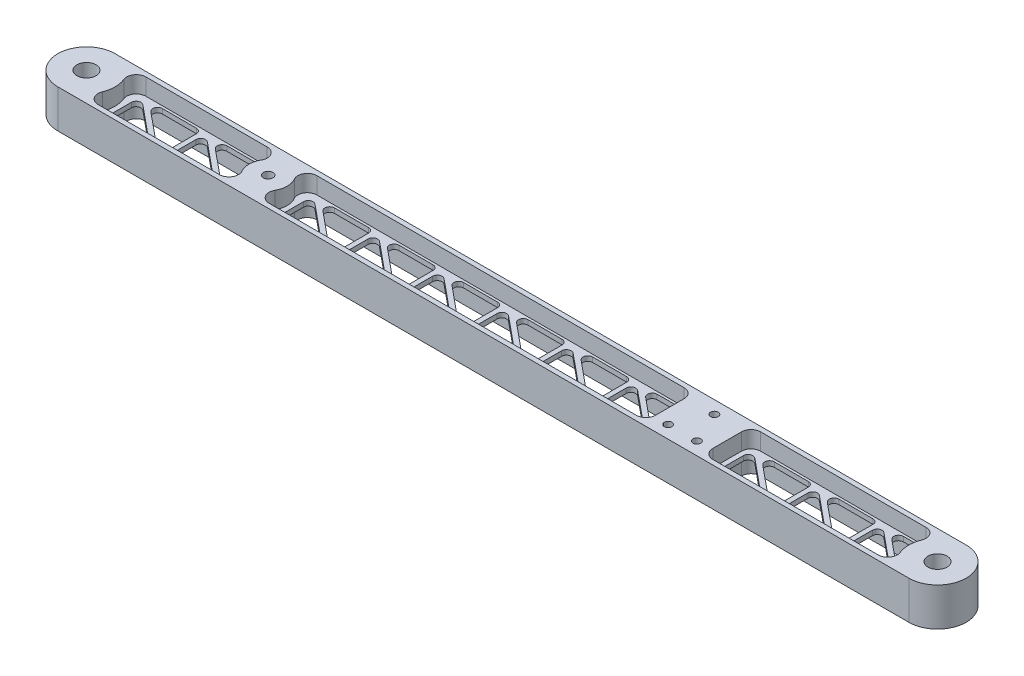
from build123d import *

# Parameters (mm, degrees)
SKETCH2_R                   = 6.35
SKETCH2_R_2                 = 3.175
BOSS_EXTRUDE1_DEPTH         = 25.4
CUT_EXTRUDE2_REACH          = 587.992
CUT_EXTRUDE3_DEPTH          = 11.1125
FILLET1_R                   = 3.175
F_1_4_20_TAPPED_HOLE1_D     = 5.1054
F_1_4_20_TAPPED_HOLE1_DEPTH = 19.05
F_1_4_20_TAPPED_HOLE1_TIP   = 1.533816902
FILLET3_R                   = 3.175
FILLET4_R                   = 3.175
FILLET5_R                   = 6.35
FILLET6_R                   = 3.175


with BuildPart() as part:
    # Sketch2 → Boss-Extrude1 (new body)
    with BuildSketch(Plane(origin=(0, 0, 0), x_dir=(1, 0, 0), z_dir=(0, 1, 0))):
        with BuildLine():
            ThreePointArc((0, 38.1), (-19.05, 19.05), (0, 0))
            Line((0, 0), (565.15, 0))
            ThreePointArc((565.15, 0), (584.2, 19.05), (565.15, 38.1))
            Line((565.15, 38.1), (0, 38.1))
        make_face()
        with Locations(Location((0, 19.05, 0), (0, 0, 270))):
            Circle(SKETCH2_R, mode=Mode.SUBTRACT)
        with Locations(Location((120.65, 19.05, 0), (0, 0, 270))):
            Circle(SKETCH2_R_2, mode=Mode.SUBTRACT)
        with Locations(Location((565.15, 19.05, 0), (0, 0, 270))):
            Circle(SKETCH2_R, mode=Mode.SUBTRACT)
    extrude(amount=BOSS_EXTRUDE1_DEPTH)

    # Sketch13 → Cut-Extrude2 (cut, up to next)
    with BuildSketch(Plane(origin=(0, 25.4, 0), x_dir=(1, 0, 0), z_dir=(0, 1, 0)), mode=Mode.PRIVATE) as cut_extrude2_sk1:
        Polygon((56.91846966, 4.7625), (22.225, 33.3375), (22.225, 4.7625), align=None)
    cut_extrude2_tool1 = extrude(cut_extrude2_sk1.sketch, amount=-CUT_EXTRUDE2_REACH, mode=Mode.PRIVATE) & part.part
    # Sketch13 → Cut-Extrude2 (cut, up to next)
    with BuildSketch(Plane(origin=(0, 25.4, 0), x_dir=(1, 0, 0), z_dir=(0, 1, 0)), mode=Mode.PRIVATE) as cut_extrude2_sk2:
        Polygon((61.9125, 33.3375), (27.21903034, 33.3375), (61.9125, 4.7625), align=None)
    cut_extrude2_tool2 = extrude(cut_extrude2_sk2.sketch, amount=-CUT_EXTRUDE2_REACH, mode=Mode.PRIVATE) & part.part
    # Sketch13 → Cut-Extrude2 (cut, up to next)
    with BuildSketch(Plane(origin=(0, 25.4, 0), x_dir=(1, 0, 0), z_dir=(0, 1, 0)), mode=Mode.PRIVATE) as cut_extrude2_sk3:
        Polygon((99.78096966, 4.7625), (65.0875, 33.3375), (65.0875, 4.7625), align=None)
    cut_extrude2_tool3 = extrude(cut_extrude2_sk3.sketch, amount=-CUT_EXTRUDE2_REACH, mode=Mode.PRIVATE) & part.part
    # Sketch13 → Cut-Extrude2 (cut, up to next)
    with BuildSketch(Plane(origin=(0, 25.4, 0), x_dir=(1, 0, 0), z_dir=(0, 1, 0)), mode=Mode.PRIVATE) as cut_extrude2_sk4:
        Polygon((104.775, 33.3375), (70.08153034, 33.3375), (104.775, 4.7625), align=None)
    cut_extrude2_tool4 = extrude(cut_extrude2_sk4.sketch, amount=-CUT_EXTRUDE2_REACH, mode=Mode.PRIVATE) & part.part
    # Sketch13 → Cut-Extrude2 (cut, up to next)
    with BuildSketch(Plane(origin=(0, 25.4, 0), x_dir=(1, 0, 0), z_dir=(0, 1, 0)), mode=Mode.PRIVATE) as cut_extrude2_sk5:
        Polygon((384.175, 5.879333612), (350.8375, 33.3375), (350.8375, 4.7625), (384.175, 4.7625), align=None)
    cut_extrude2_tool5 = extrude(cut_extrude2_sk5.sketch, amount=-CUT_EXTRUDE2_REACH, mode=Mode.PRIVATE) & part.part
    # Sketch13 → Cut-Extrude2 (cut, up to next)
    with BuildSketch(Plane(origin=(0, 25.4, 0), x_dir=(1, 0, 0), z_dir=(0, 1, 0)), mode=Mode.PRIVATE) as cut_extrude2_sk6:
        Polygon((384.175, 33.3375), (355.83153034, 33.3375), (384.175, 9.992626931), align=None)
    cut_extrude2_tool6 = extrude(cut_extrude2_sk6.sketch, amount=-CUT_EXTRUDE2_REACH, mode=Mode.PRIVATE) & part.part
    # Sketch13 → Cut-Extrude2 (cut, up to next)
    with BuildSketch(Plane(origin=(0, 25.4, 0), x_dir=(1, 0, 0), z_dir=(0, 1, 0)), mode=Mode.PRIVATE) as cut_extrude2_sk7:
        Polygon((171.21846966, 4.7625), (136.525, 33.3375), (136.525, 4.7625), align=None)
    cut_extrude2_tool7 = extrude(cut_extrude2_sk7.sketch, amount=-CUT_EXTRUDE2_REACH, mode=Mode.PRIVATE) & part.part
    # Sketch13 → Cut-Extrude2 (cut, up to next)
    with BuildSketch(Plane(origin=(0, 25.4, 0), x_dir=(1, 0, 0), z_dir=(0, 1, 0)), mode=Mode.PRIVATE) as cut_extrude2_sk8:
        Polygon((176.2125, 33.3375), (141.51903034, 33.3375), (176.2125, 4.7625), align=None)
    cut_extrude2_tool8 = extrude(cut_extrude2_sk8.sketch, amount=-CUT_EXTRUDE2_REACH, mode=Mode.PRIVATE) & part.part
    # Sketch13 → Cut-Extrude2 (cut, up to next)
    with BuildSketch(Plane(origin=(0, 25.4, 0), x_dir=(1, 0, 0), z_dir=(0, 1, 0)), mode=Mode.PRIVATE) as cut_extrude2_sk9:
        Polygon((214.08096966, 4.7625), (179.3875, 33.3375), (179.3875, 4.7625), align=None)
    cut_extrude2_tool9 = extrude(cut_extrude2_sk9.sketch, amount=-CUT_EXTRUDE2_REACH, mode=Mode.PRIVATE) & part.part
    # Sketch13 → Cut-Extrude2 (cut, up to next)
    with BuildSketch(Plane(origin=(0, 25.4, 0), x_dir=(1, 0, 0), z_dir=(0, 1, 0)), mode=Mode.PRIVATE) as cut_extrude2_sk10:
        Polygon((219.075, 33.3375), (184.38153034, 33.3375), (219.075, 4.7625), align=None)
    cut_extrude2_tool10 = extrude(cut_extrude2_sk10.sketch, amount=-CUT_EXTRUDE2_REACH, mode=Mode.PRIVATE) & part.part
    # Sketch13 → Cut-Extrude2 (cut, up to next)
    with BuildSketch(Plane(origin=(0, 25.4, 0), x_dir=(1, 0, 0), z_dir=(0, 1, 0)), mode=Mode.PRIVATE) as cut_extrude2_sk11:
        Polygon((256.94346966, 4.7625), (222.25, 33.3375), (222.25, 4.7625), align=None)
    cut_extrude2_tool11 = extrude(cut_extrude2_sk11.sketch, amount=-CUT_EXTRUDE2_REACH, mode=Mode.PRIVATE) & part.part
    # Sketch13 → Cut-Extrude2 (cut, up to next)
    with BuildSketch(Plane(origin=(0, 25.4, 0), x_dir=(1, 0, 0), z_dir=(0, 1, 0)), mode=Mode.PRIVATE) as cut_extrude2_sk12:
        Polygon((261.9375, 33.3375), (227.24403034, 33.3375), (261.9375, 4.7625), align=None)
    cut_extrude2_tool12 = extrude(cut_extrude2_sk12.sketch, amount=-CUT_EXTRUDE2_REACH, mode=Mode.PRIVATE) & part.part
    # Sketch13 → Cut-Extrude2 (cut, up to next)
    with BuildSketch(Plane(origin=(0, 25.4, 0), x_dir=(1, 0, 0), z_dir=(0, 1, 0)), mode=Mode.PRIVATE) as cut_extrude2_sk13:
        Polygon((299.80596966, 4.7625), (265.1125, 33.3375), (265.1125, 4.7625), align=None)
    cut_extrude2_tool13 = extrude(cut_extrude2_sk13.sketch, amount=-CUT_EXTRUDE2_REACH, mode=Mode.PRIVATE) & part.part
    # Sketch13 → Cut-Extrude2 (cut, up to next)
    with BuildSketch(Plane(origin=(0, 25.4, 0), x_dir=(1, 0, 0), z_dir=(0, 1, 0)), mode=Mode.PRIVATE) as cut_extrude2_sk14:
        Polygon((304.8, 33.3375), (270.10653034, 33.3375), (304.8, 4.7625), align=None)
    cut_extrude2_tool14 = extrude(cut_extrude2_sk14.sketch, amount=-CUT_EXTRUDE2_REACH, mode=Mode.PRIVATE) & part.part
    # Sketch13 → Cut-Extrude2 (cut, up to next)
    with BuildSketch(Plane(origin=(0, 25.4, 0), x_dir=(1, 0, 0), z_dir=(0, 1, 0)), mode=Mode.PRIVATE) as cut_extrude2_sk15:
        Polygon((342.66846966, 4.7625), (307.975, 33.3375), (307.975, 4.7625), align=None)
    cut_extrude2_tool15 = extrude(cut_extrude2_sk15.sketch, amount=-CUT_EXTRUDE2_REACH, mode=Mode.PRIVATE) & part.part
    # Sketch13 → Cut-Extrude2 (cut, up to next)
    with BuildSketch(Plane(origin=(0, 25.4, 0), x_dir=(1, 0, 0), z_dir=(0, 1, 0)), mode=Mode.PRIVATE) as cut_extrude2_sk16:
        Polygon((347.6625, 33.3375), (312.96903034, 33.3375), (347.6625, 4.7625), align=None)
    cut_extrude2_tool16 = extrude(cut_extrude2_sk16.sketch, amount=-CUT_EXTRUDE2_REACH, mode=Mode.PRIVATE) & part.part
    # Sketch13 → Cut-Extrude2 (cut, up to next)
    with BuildSketch(Plane(origin=(0, 25.4, 0), x_dir=(1, 0, 0), z_dir=(0, 1, 0)), mode=Mode.PRIVATE) as cut_extrude2_sk17:
        with BuildLine():
            ThreePointArc((543.684455535, 13.289702626), (543.4511385, 23.857289738), (548.125959095, 33.3375))
            Line((548.125959095, 33.3375), (519.34403034, 33.3375))
            Line((519.34403034, 33.3375), (543.684455535, 13.289702626))
        make_face()
    cut_extrude2_tool17 = extrude(cut_extrude2_sk17.sketch, amount=-CUT_EXTRUDE2_REACH, mode=Mode.PRIVATE) & part.part
    # Sketch13 → Cut-Extrude2 (cut, up to next)
    with BuildSketch(Plane(origin=(0, 25.4, 0), x_dir=(1, 0, 0), z_dir=(0, 1, 0)), mode=Mode.PRIVATE) as cut_extrude2_sk18:
        with BuildLine():
            ThreePointArc((548.125959095, 4.7625), (547.360233209, 5.728032333), (546.649199715, 6.734521373))
            Line((546.649199715, 6.734521373), (514.35, 33.3375))
            Line((514.35, 33.3375), (514.35, 4.7625))
            Line((514.35, 4.7625), (548.125959095, 4.7625))
        make_face()
    cut_extrude2_tool18 = extrude(cut_extrude2_sk18.sketch, amount=-CUT_EXTRUDE2_REACH, mode=Mode.PRIVATE) & part.part
    # Sketch13 → Cut-Extrude2 (cut, up to next)
    with BuildSketch(Plane(origin=(0, 25.4, 0), x_dir=(1, 0, 0), z_dir=(0, 1, 0)), mode=Mode.PRIVATE) as cut_extrude2_sk19:
        Polygon((463.31846966, 4.7625), (428.625, 33.3375), (428.625, 4.7625), align=None)
    cut_extrude2_tool19 = extrude(cut_extrude2_sk19.sketch, amount=-CUT_EXTRUDE2_REACH, mode=Mode.PRIVATE) & part.part
    # Sketch13 → Cut-Extrude2 (cut, up to next)
    with BuildSketch(Plane(origin=(0, 25.4, 0), x_dir=(1, 0, 0), z_dir=(0, 1, 0)), mode=Mode.PRIVATE) as cut_extrude2_sk20:
        Polygon((468.3125, 33.3375), (433.61903034, 33.3375), (468.3125, 4.7625), align=None)
    cut_extrude2_tool20 = extrude(cut_extrude2_sk20.sketch, amount=-CUT_EXTRUDE2_REACH, mode=Mode.PRIVATE) & part.part
    # Sketch13 → Cut-Extrude2 (cut, up to next)
    with BuildSketch(Plane(origin=(0, 25.4, 0), x_dir=(1, 0, 0), z_dir=(0, 1, 0)), mode=Mode.PRIVATE) as cut_extrude2_sk21:
        Polygon((506.18096966, 4.7625), (471.4875, 33.3375), (471.4875, 4.7625), align=None)
    cut_extrude2_tool21 = extrude(cut_extrude2_sk21.sketch, amount=-CUT_EXTRUDE2_REACH, mode=Mode.PRIVATE) & part.part
    # Sketch13 → Cut-Extrude2 (cut, up to next)
    with BuildSketch(Plane(origin=(0, 25.4, 0), x_dir=(1, 0, 0), z_dir=(0, 1, 0)), mode=Mode.PRIVATE) as cut_extrude2_sk22:
        Polygon((511.175, 33.3375), (476.48153034, 33.3375), (511.175, 4.7625), align=None)
    cut_extrude2_tool22 = extrude(cut_extrude2_sk22.sketch, amount=-CUT_EXTRUDE2_REACH, mode=Mode.PRIVATE) & part.part
    add(cut_extrude2_tool1.solids().sort_by_distance((33.78949, 25.4, -14.2875))[0], mode=Mode.SUBTRACT)
    add(cut_extrude2_tool2.solids().sort_by_distance((50.34801, 25.4, -23.8125))[0], mode=Mode.SUBTRACT)
    add(cut_extrude2_tool3.solids().sort_by_distance((76.65199, 25.4, -14.2875))[0], mode=Mode.SUBTRACT)
    add(cut_extrude2_tool4.solids().sort_by_distance((93.21051, 25.4, -23.8125))[0], mode=Mode.SUBTRACT)
    add(cut_extrude2_tool5.solids().sort_by_distance((362.367987, 25.4, -14.301503))[0], mode=Mode.SUBTRACT)
    add(cut_extrude2_tool6.solids().sort_by_distance((374.727177, 25.4, -25.555876))[0], mode=Mode.SUBTRACT)
    add(cut_extrude2_tool7.solids().sort_by_distance((148.08949, 25.4, -14.2875))[0], mode=Mode.SUBTRACT)
    add(cut_extrude2_tool8.solids().sort_by_distance((164.64801, 25.4, -23.8125))[0], mode=Mode.SUBTRACT)
    add(cut_extrude2_tool9.solids().sort_by_distance((190.95199, 25.4, -14.2875))[0], mode=Mode.SUBTRACT)
    add(cut_extrude2_tool10.solids().sort_by_distance((207.51051, 25.4, -23.8125))[0], mode=Mode.SUBTRACT)
    add(cut_extrude2_tool11.solids().sort_by_distance((233.81449, 25.4, -14.2875))[0], mode=Mode.SUBTRACT)
    add(cut_extrude2_tool12.solids().sort_by_distance((250.37301, 25.4, -23.8125))[0], mode=Mode.SUBTRACT)
    add(cut_extrude2_tool13.solids().sort_by_distance((276.67699, 25.4, -14.2875))[0], mode=Mode.SUBTRACT)
    add(cut_extrude2_tool14.solids().sort_by_distance((293.23551, 25.4, -23.8125))[0], mode=Mode.SUBTRACT)
    add(cut_extrude2_tool15.solids().sort_by_distance((319.53949, 25.4, -14.2875))[0], mode=Mode.SUBTRACT)
    add(cut_extrude2_tool16.solids().sort_by_distance((336.09801, 25.4, -23.8125))[0], mode=Mode.SUBTRACT)
    add(cut_extrude2_tool17.solids().sort_by_distance((535.971737, 25.4, -27.083486))[0], mode=Mode.SUBTRACT)
    add(cut_extrude2_tool18.solids().sort_by_distance((525.871779, 25.4, -14.304685))[0], mode=Mode.SUBTRACT)
    add(cut_extrude2_tool19.solids().sort_by_distance((440.18949, 25.4, -14.2875))[0], mode=Mode.SUBTRACT)
    add(cut_extrude2_tool20.solids().sort_by_distance((456.74801, 25.4, -23.8125))[0], mode=Mode.SUBTRACT)
    add(cut_extrude2_tool21.solids().sort_by_distance((483.05199, 25.4, -14.2875))[0], mode=Mode.SUBTRACT)
    add(cut_extrude2_tool22.solids().sort_by_distance((499.61051, 25.4, -23.8125))[0], mode=Mode.SUBTRACT)

    # Sketch13<4> → Cut-Extrude3 (cut)
    # profile 1 of 3: a face of its own
    with BuildSketch(Plane(origin=(0, 25.4, 0), x_dir=(1, 0, 0), z_dir=(0, 1, 0))):
        with BuildLine():
            ThreePointArc((109.651477372, 25.4), (109.651477372, 31.75), (104.152216058, 34.925))
            Line((104.152216058, 34.925), (10.530283709, 34.925))
            ThreePointArc((10.530283709, 34.925), (16.785475934, 28.058346001), (19.05, 19.05))
            ThreePointArc((19.05, 19.05), (16.785475934, 10.041653999), (10.530283709, 3.175))
            Line((10.530283709, 3.175), (104.152216058, 3.175))
            ThreePointArc((104.152216058, 3.175), (109.651477372, 6.35), (109.651477372, 12.7))
            ThreePointArc((109.651477372, 12.7), (107.95, 19.05), (109.651477372, 25.4))
        make_face()
        Polygon((22.225, 4.7625), (22.225, 33.3375), (56.91846966, 4.7625), align=None, mode=Mode.SUBTRACT)
        Polygon((61.9125, 4.7625), (27.21903034, 33.3375), (61.9125, 33.3375), align=None, mode=Mode.SUBTRACT)
        Polygon((65.0875, 4.7625), (65.0875, 33.3375), (99.78096966, 4.7625), align=None, mode=Mode.SUBTRACT)
        Polygon((104.775, 4.7625), (70.08153034, 33.3375), (104.775, 33.3375), align=None, mode=Mode.SUBTRACT)
    # profile 2 of 3: a face of its own
    with BuildSketch(Plane(origin=(0, 25.4, 0), x_dir=(1, 0, 0), z_dir=(0, 1, 0))):
        with BuildLine():
            Line((554.619716291, 34.925), (425.45, 34.925))
            Line((425.45, 34.925), (425.45, 3.175))
            Line((425.45, 3.175), (550.970884641, 3.175))
            Line((550.970884641, 3.175), (554.619716291, 3.175))
            ThreePointArc((554.619716291, 3.175), (546.1, 19.05), (554.619716291, 34.925))
        make_face()
        Polygon((428.625, 4.7625), (428.625, 33.3375), (463.31846966, 4.7625), align=None, mode=Mode.SUBTRACT)
        Polygon((468.3125, 4.7625), (433.61903034, 33.3375), (468.3125, 33.3375), align=None, mode=Mode.SUBTRACT)
        Polygon((471.4875, 4.7625), (471.4875, 33.3375), (506.18096966, 4.7625), align=None, mode=Mode.SUBTRACT)
        Polygon((511.175, 4.7625), (476.48153034, 33.3375), (511.175, 33.3375), align=None, mode=Mode.SUBTRACT)
        with BuildLine():
            Line((514.35, 33.3375), (546.649199715, 6.734521373))
            ThreePointArc((546.649199715, 6.734521373), (547.360233209, 5.728032333), (548.125959095, 4.7625))
            Line((548.125959095, 4.7625), (514.35, 4.7625))
            Line((514.35, 4.7625), (514.35, 33.3375))
        make_face(mode=Mode.SUBTRACT)
        with BuildLine():
            Line((519.34403034, 33.3375), (548.125959095, 33.3375))
            ThreePointArc((548.125959095, 33.3375), (543.4511385, 23.857289738), (543.684455535, 13.289702626))
            Line((543.684455535, 13.289702626), (519.34403034, 33.3375))
        make_face(mode=Mode.SUBTRACT)
    # profile 3 of 3: a face of its own
    with BuildSketch(Plane(origin=(0, 25.4, 0), x_dir=(1, 0, 0), z_dir=(0, 1, 0))):
        with BuildLine():
            Line((387.35, 34.925), (137.147783942, 34.925))
            ThreePointArc((137.147783942, 34.925), (131.648522628, 31.75), (131.648522628, 25.4))
            ThreePointArc((131.648522628, 25.4), (133.35, 19.05), (131.648522628, 12.7))
            ThreePointArc((131.648522628, 12.7), (131.648522628, 6.35), (137.147783942, 3.175))
            Line((137.147783942, 3.175), (387.35, 3.175))
            Line((387.35, 3.175), (387.35, 34.925))
        make_face()
        Polygon((136.525, 4.7625), (136.525, 33.3375), (171.21846966, 4.7625), align=None, mode=Mode.SUBTRACT)
        Polygon((176.2125, 4.7625), (141.51903034, 33.3375), (176.2125, 33.3375), align=None, mode=Mode.SUBTRACT)
        Polygon((179.3875, 4.7625), (179.3875, 33.3375), (214.08096966, 4.7625), align=None, mode=Mode.SUBTRACT)
        Polygon((219.075, 4.7625), (184.38153034, 33.3375), (219.075, 33.3375), align=None, mode=Mode.SUBTRACT)
        Polygon((222.25, 4.7625), (222.25, 33.3375), (256.94346966, 4.7625), align=None, mode=Mode.SUBTRACT)
        Polygon((261.9375, 4.7625), (227.24403034, 33.3375), (261.9375, 33.3375), align=None, mode=Mode.SUBTRACT)
        Polygon((265.1125, 4.7625), (265.1125, 33.3375), (299.80596966, 4.7625), align=None, mode=Mode.SUBTRACT)
        Polygon((304.8, 4.7625), (270.10653034, 33.3375), (304.8, 33.3375), align=None, mode=Mode.SUBTRACT)
        Polygon((307.975, 4.7625), (307.975, 33.3375), (342.66846966, 4.7625), align=None, mode=Mode.SUBTRACT)
        Polygon((347.6625, 4.7625), (312.96903034, 33.3375), (347.6625, 33.3375), align=None, mode=Mode.SUBTRACT)
        Polygon((350.8375, 4.7625), (350.8375, 33.3375), (384.175, 5.879333612), (384.175, 4.7625), align=None, mode=Mode.SUBTRACT)
        Polygon((384.175, 9.992626931), (355.83153034, 33.3375), (384.175, 33.3375), align=None, mode=Mode.SUBTRACT)
    cut_extrude3 = extrude(amount=-CUT_EXTRUDE3_DEPTH, mode=Mode.SUBTRACT)

    # Mirror1: Cut-Extrude3 across plane
    add(cut_extrude3.mirror(Plane(origin=(0, 12.7, 0), x_dir=(0, 0, 1), z_dir=(0, -1, 0))), mode=Mode.SUBTRACT)

    # Fillet1
    fillet1_edges = [part.edges().sort_by_distance(p)[0] for p in [
        (70.08153034, 12.7, -33.3375),
        (104.775, 12.7, -33.3375),
        (104.775, 12.7, -4.7625),
        (65.0875, 12.7, -33.3375),
        (99.78096966, 12.7, -4.7625),
        (65.0875, 12.7, -4.7625),
        (27.21903034, 12.7, -33.3375),
        (61.9125, 12.7, -33.3375),
        (61.9125, 12.7, -4.7625),
        (22.225, 12.7, -33.3375),
        (56.91846966, 12.7, -4.7625),
        (22.225, 12.7, -4.7625),
        (471.4875, 12.7, -33.3375),
        (506.18096966, 12.7, -4.7625),
        (471.4875, 12.7, -4.7625),
        (476.48153034, 12.7, -33.3375),
        (511.175, 12.7, -33.3375),
        (511.175, 12.7, -4.7625),
        (514.35, 12.7, -33.3375),
        (514.35, 12.7, -4.7625),
        (548.125959095, 12.7, -33.3375),
        (543.684455535, 12.7, -13.289702626),
        (433.61903034, 12.7, -33.3375),
        (468.3125, 12.7, -33.3375),
        (468.3125, 12.7, -4.7625),
        (428.625, 12.7, -33.3375),
        (463.31846966, 12.7, -4.7625),
        (428.625, 12.7, -4.7625),
        (265.1125, 12.7, -33.3375),
        (299.80596966, 12.7, -4.7625),
        (265.1125, 12.7, -4.7625),
        (355.83153034, 12.7, -33.3375),
        (384.175, 12.7, -33.3375),
        (384.175, 12.7, -9.992626931),
        (350.8375, 12.7, -33.3375),
        (350.8375, 12.7, -4.7625),
        (312.96903034, 12.7, -33.3375),
        (347.6625, 12.7, -33.3375),
        (347.6625, 12.7, -4.7625),
        (307.975, 12.7, -33.3375),
        (342.66846966, 12.7, -4.7625),
        (307.975, 12.7, -4.7625),
        (270.10653034, 12.7, -33.3375),
        (304.8, 12.7, -33.3375),
        (304.8, 12.7, -4.7625),
        (227.24403034, 12.7, -33.3375),
        (261.9375, 12.7, -33.3375),
        (261.9375, 12.7, -4.7625),
        (222.25, 12.7, -33.3375),
        (256.94346966, 12.7, -4.7625),
        (222.25, 12.7, -4.7625),
        (184.38153034, 12.7, -33.3375),
        (219.075, 12.7, -33.3375),
        (219.075, 12.7, -4.7625),
        (179.3875, 12.7, -33.3375),
        (214.08096966, 12.7, -4.7625),
        (179.3875, 12.7, -4.7625),
        (141.51903034, 12.7, -33.3375),
        (176.2125, 12.7, -33.3375),
        (176.2125, 12.7, -4.7625),
        (136.525, 12.7, -33.3375),
        (171.21846966, 12.7, -4.7625),
        (136.525, 12.7, -4.7625),
    ]]
    fillet(fillet1_edges, radius=FILLET1_R)

    # 1/4-20 Tapped Hole1
    with Locations(Plane(origin=(396.875, 25.4, -8.466666667), x_dir=(0, 0, 1), z_dir=(0, 1, 0))):
        with Locations((0, 0), (0, 19.05), (-21.166666666, 9.525)):
            Hole(F_1_4_20_TAPPED_HOLE1_D / 2, depth=F_1_4_20_TAPPED_HOLE1_DEPTH)
            with Locations((0, 0, -(F_1_4_20_TAPPED_HOLE1_DEPTH + F_1_4_20_TAPPED_HOLE1_TIP / 2))):  # 118° drill point
                Cone(0, F_1_4_20_TAPPED_HOLE1_D / 2, F_1_4_20_TAPPED_HOLE1_TIP, mode=Mode.SUBTRACT)

    # Fillet3
    # the kernel refuses this fillet: 3.175 mm, written as the material it adds along each edge
    with BuildSketch(Plane(origin=(548.125959095, 14.2875, -4.7625), x_dir=(-1, 0, 0), z_dir=(0, -1, 0))) as fillet3_piece_1:
        with BuildLine():
            CenterArc((7.931349737, 3.175), FILLET3_R, 129.476304775, 140.523695225)
            Line((5.912814743, 5.625743047), (5.710961244, 5.870817351))
            ThreePointArc((5.710961244, 5.870817351), (1.274905881, 2.217095678), (-0.243200584, 0.204107143))
            Line((-0.243200584, 0.204107143), (0, -0.3175))
            Line((0, -0.3175), (7.931349737, -0.3175))
            Line((7.931349737, -0.3175), (7.931349737, 0))
        make_face()
    extrude(amount=3.175)

    # Fillet4
    fillet4_edges = [part.edges().sort_by_distance(p)[0] for p in [
        (519.34403034, 12.7, -33.3375),
    ]]
    fillet(fillet4_edges, radius=FILLET4_R)

    # Fillet5
    fillet5_edges = [part.edges().sort_by_distance(p)[0] for p in [
        (10.530283709, 19.84375, -3.175),
        (10.530283709, 19.84375, -34.925),
        (554.619716291, 19.84375, -34.925),
        (554.619716291, 19.84375, -3.175),
        (425.45, 19.84375, -3.175),
        (425.45, 19.84375, -34.925),
        (387.35, 19.84375, -34.925),
        (387.35, 19.84375, -3.175),
        (10.530283709, 5.55625, -34.925),
        (10.530283709, 5.55625, -3.175),
        (554.619716291, 5.55625, -3.175),
        (554.619716291, 5.55625, -34.925),
        (425.45, 5.55625, -34.925),
        (425.45, 5.55625, -3.175),
        (387.35, 5.55625, -3.175),
        (387.35, 5.55625, -34.925),
    ]]
    fillet(fillet5_edges, radius=FILLET5_R)

    # Fillet6
    # the kernel refuses this fillet: 3.175 mm, written as the material it adds along each edge
    with BuildSketch(Plane(origin=(384.175, 14.2875, -5.879333612), x_dir=(-0.7718875737059745, 0, -0.6357590530683018), z_dir=(0, -1, 0))) as fillet6_piece_1:
        with BuildLine():
            CenterArc((7.092167092, -3.175), FILLET6_R, 90, 140.523695225)
            Line((5.073632098, -5.625743047), (4.871778599, -5.870817351))
            ThreePointArc((4.871778599, -5.870817351), (-0.911890579, -1.107144292), (-0.245074305, 0.201853499))
            Line((-0.245074305, 0.201853499), (0, 0.3175))
            Line((0, 0.3175), (7.092167092, 0.3175))
            Line((7.092167092, 0.3175), (7.092167092, 0))
        make_face()
    extrude(amount=3.175)
    with BuildSketch(Plane(origin=(384.175, 14.2875, -4.7625), x_dir=(-1, 0, 0), z_dir=(0, -1, 0))) as fillet6_piece_2:
        with BuildLine():
            CenterArc((7.492890642, 3.175), FILLET6_R, 129.476304775, 140.523695225)
            Line((5.474355649, 5.625743047), (5.27250215, 5.870817351))
            ThreePointArc((5.27250215, 5.870817351), (-0.201853499, 1.361907917), (-0.3175, 0))
            Line((-0.3175, 0), (0, -0.3175))
            Line((0, -0.3175), (7.492890642, -0.3175))
            Line((7.492890642, -0.3175), (7.492890642, 0))
        make_face()
    extrude(amount=3.175)


solid = part.part
